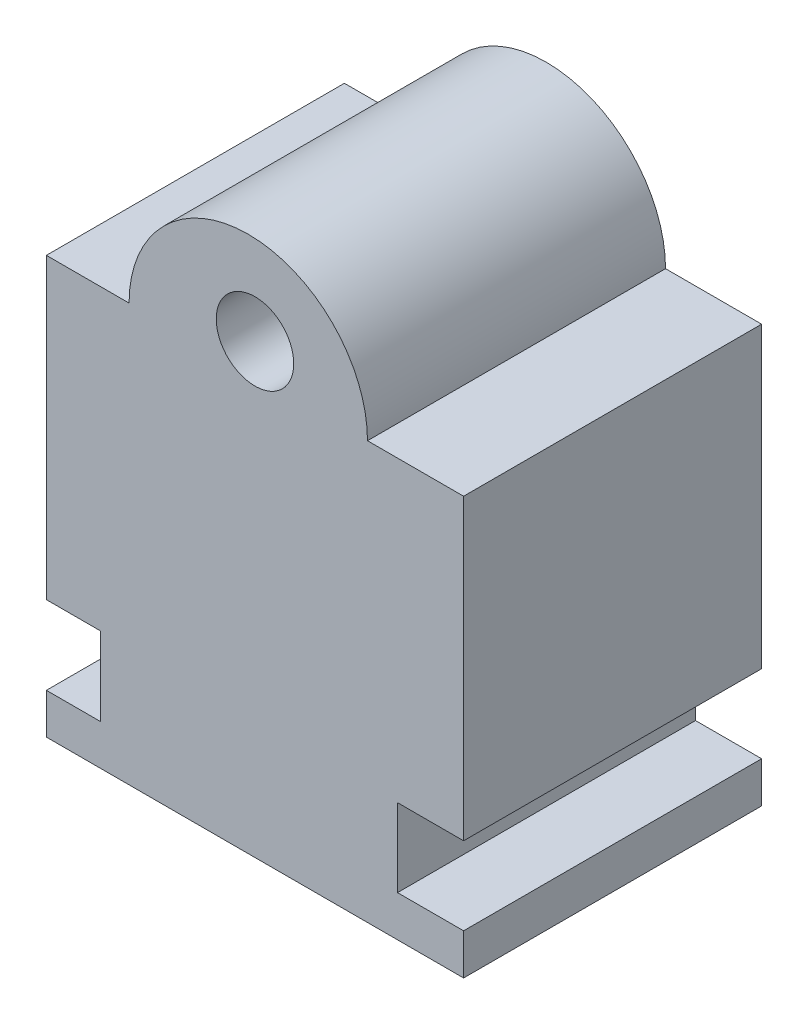
from build123d import *

# Parameters (mm, degrees)
BOSS_EXTRU_1_DEPTH      = 500
ESQUISSE2_W             = 700
ESQUISSE2_H             = 500
BOSS_EXTRU_2_DEPTH      = 250
ESQUISSE3_R             = 65
ENL_V_MAT_EXTRU_1_DEPTH = 500
ESQUISSE4_W             = 91.072749712
ESQUISSE4_H             = 131.669737078
ENL_V_MAT_EXTRU_2_DEPTH = 500
ESQUISSE5_W             = 110.887682399
ESQUISSE5_H             = 130.745719327
ENL_V_MAT_EXTRU_3_DEPTH = 500


with BuildPart() as part:
    # Esquisse1 → Boss.-Extru.1 (new body)
    with BuildSketch(Plane.XY):
        with BuildLine():
            Line((0, 0), (700, 0))
            Line((700, 0), (700, 450))
            Line((700, 450), (538.758062097, 450))
            ThreePointArc((538.758062097, 450), (338.758062097, 650), (138.758062097, 450))
            Line((138.758062097, 450), (0, 450))
            Line((0, 450), (0, 0))
        make_face()
    extrude(amount=BOSS_EXTRU_1_DEPTH)

    # Esquisse2 → Boss.-Extru.2 (add)
    with BuildSketch(Plane.XZ):
        with Locations((350, 250)):
            Rectangle(ESQUISSE2_W, ESQUISSE2_H)
    extrude(amount=BOSS_EXTRU_2_DEPTH)

    # Esquisse3 → Enlèv. mat.-Extru.1 (cut)
    with BuildSketch(Plane(origin=(0, 0, 0), x_dir=(-1, 0, 0), z_dir=(0, 0, -1))):
        with Locations((-350, 500)):
            Circle(ESQUISSE3_R)
    extrude(amount=-ENL_V_MAT_EXTRU_1_DEPTH, mode=Mode.SUBTRACT)

    # Esquisse4 → Enlèv. mat.-Extru.2 (cut)
    with BuildSketch(Plane(origin=(0, 0, 0), x_dir=(-1, 0, 0), z_dir=(0, 0, -1))):
        with Locations((-45.536374856, -116.153722116)):
            Rectangle(ESQUISSE4_W, ESQUISSE4_H)
    extrude(amount=-ENL_V_MAT_EXTRU_2_DEPTH, mode=Mode.SUBTRACT)

    # Esquisse5 → Enlèv. mat.-Extru.3 (cut)
    with BuildSketch(Plane(origin=(0, 0, 0), x_dir=(-1, 0, 0), z_dir=(0, 0, -1))):
        with Locations((-644.556158801, -116.03155185)):
            Rectangle(ESQUISSE5_W, ESQUISSE5_H)
    extrude(amount=-ENL_V_MAT_EXTRU_3_DEPTH, mode=Mode.SUBTRACT)


solid = part.part
